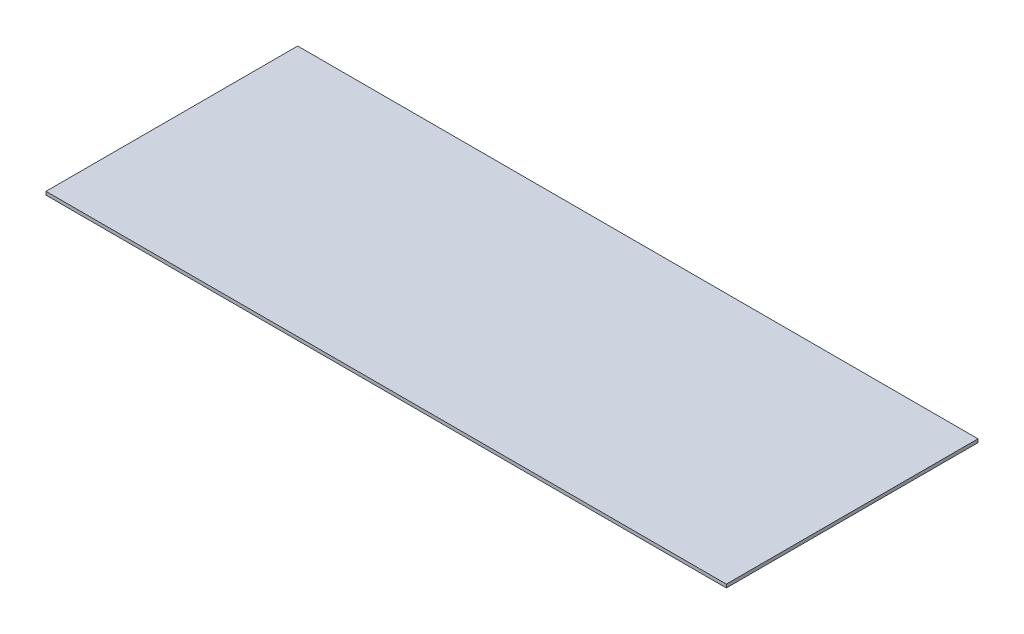
from build123d import *

# Parameters (mm, degrees)
SKIZZE1_W                       = 811
SKIZZE1_H                       = 4
AUFSATZ_LINEAR_AUSTRAGEN1_DEPTH = 300


with BuildPart() as part:
    # Skizze1 → Aufsatz-Linear austragen1 (new body)
    with BuildSketch(Plane.XY):
        with Locations((0, 2)):
            Rectangle(SKIZZE1_W, SKIZZE1_H)
    extrude(amount=AUFSATZ_LINEAR_AUSTRAGEN1_DEPTH)


solid = part.part
